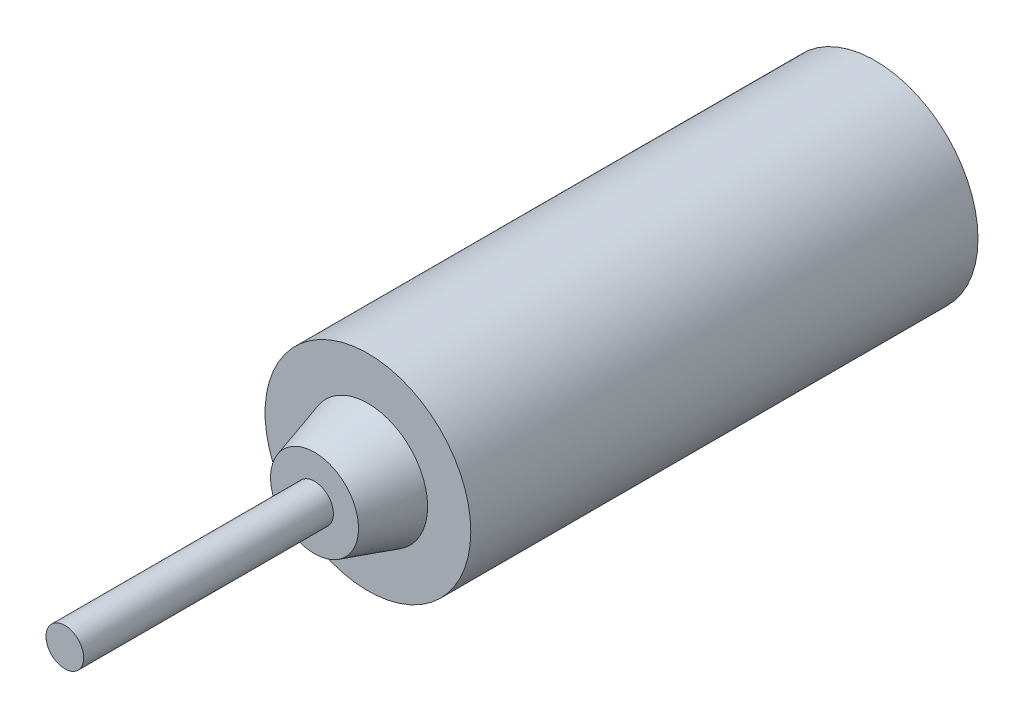
from build123d import *

# Parameters (mm, degrees)
SKETCH1_R           = 32.75
BOSS_EXTRUDE1_DEPTH = 80.75
SKETCH12_R          = 6
BOSS_EXTRUDE5_DEPTH = 79.5


with BuildPart() as part:
    # Sketch1 → Boss-Extrude1 (new, symmetric)
    with BuildSketch(Plane.XY):
        Circle(SKETCH1_R)
    extrude(amount=BOSS_EXTRUDE1_DEPTH, both=True)

    # Sketch10 → Revolve1 (revolve)
    with BuildSketch(Plane(origin=(0, 0, 0), x_dir=(0, 0, -1), z_dir=(1, 0, 0))):
        Polygon((-97.75, 0), (-97.75, 14), (-80.75, 19), (-80.75, 0), align=None)
    revolve(axis=Axis((0, 0, 1000), (0, 0, -1)))

    # Sketch12 → Boss-Extrude5 (add)
    with BuildSketch(Plane.XY.offset(97.75)):
        Circle(SKETCH12_R)
    extrude(amount=BOSS_EXTRUDE5_DEPTH)


solid = part.part
